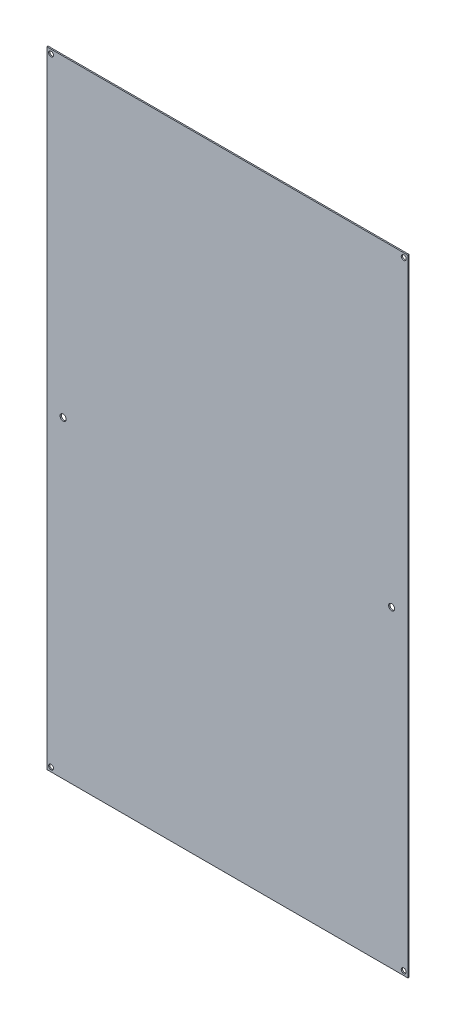
from build123d import *

# Parameters (mm, degrees)
SKETCH1_W           = 466
SKETCH1_H           = 807.900101531
SKETCH1_R           = 3.175
SKETCH1_R_2         = 3.96875
BOSS_EXTRUDE1_DEPTH = 1.6002


with BuildPart() as part:
    # Sketch1 → Boss-Extrude1 (new body)
    with BuildSketch(Plane.XY):
        with Locations((125.152406859, 514.031444865)):
            Rectangle(SKETCH1_W, SKETCH1_H)
        with Locations((-102.405393141, 115.522426029)):
            Circle(SKETCH1_R, mode=Mode.SUBTRACT)
        with Locations((352.710206859, 115.522426029)):
            Circle(SKETCH1_R, mode=Mode.SUBTRACT)
        with Locations((-102.405393141, 912.54036218)):
            Circle(SKETCH1_R, mode=Mode.SUBTRACT)
        with Locations((352.710206859, 912.54036218)):
            Circle(SKETCH1_R, mode=Mode.SUBTRACT)
        with Locations((-86.893613141, 514.031444864)):
            Circle(SKETCH1_R_2, mode=Mode.SUBTRACT)
        with Locations((337.198426859, 514.031444864)):
            Circle(SKETCH1_R_2, mode=Mode.SUBTRACT)
    extrude(amount=BOSS_EXTRUDE1_DEPTH)


solid = part.part
